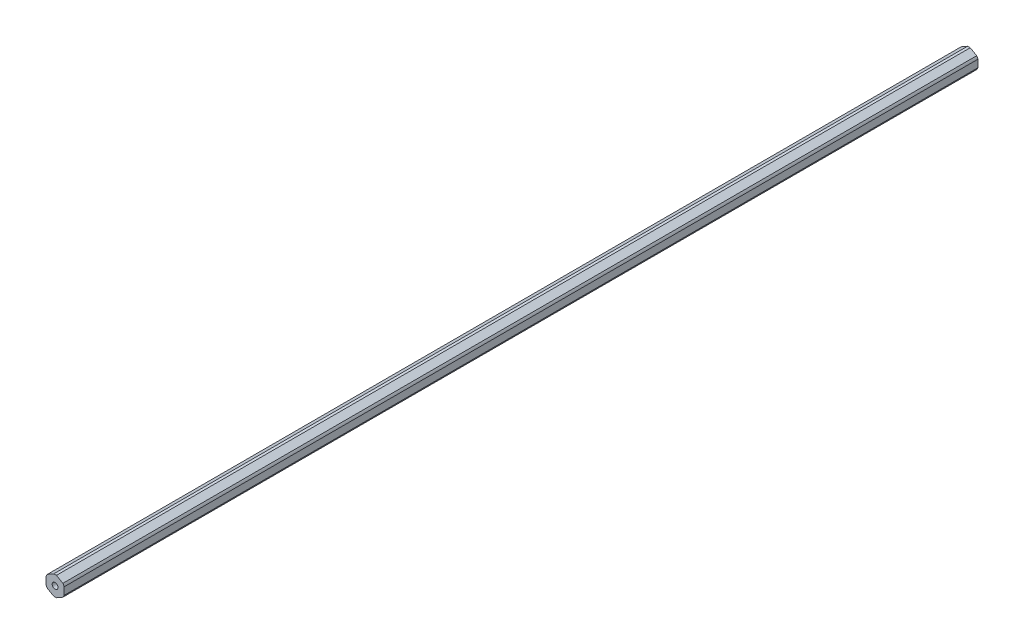
from build123d import *

# Parameters (mm, degrees)
BOSS_EXTRUDE1_DEPTH                  = 319.0875
F_10_32_TAPPED_HOLE1_D               = 4.0386
F_10_32_TAPPED_HOLE1_DEPTH           = 11.938
F_10_32_TAPPED_HOLE1_TIP             = 1.213317848
F_10_32_TAPPED_HOLE1_ON_FACE_2_D     = 4.0386
F_10_32_TAPPED_HOLE1_ON_FACE_2_DEPTH = 11.938
F_10_32_TAPPED_HOLE1_ON_FACE_2_TIP   = 1.213317848


with BuildPart() as part:
    # Sketch1 → Boss-Extrude1 (new, symmetric)
    with BuildSketch(Plane.XY):
        with BuildLine():
            ThreePointArc((0.93173274, 6.79441227), (0, 6.858), (-0.93173274, 6.79441227))
            Line((-0.93173274, 6.79441227), (-5.41826726, 4.204110358))
            ThreePointArc((-5.41826726, 4.204110358), (-5.939202219, 3.429), (-6.35, 2.590301913))
            Line((-6.35, 2.590301913), (-6.35, -2.590301913))
            ThreePointArc((-6.35, -2.590301913), (-5.939202219, -3.429), (-5.41826726, -4.204110358))
            Line((-5.41826726, -4.204110358), (-0.93173274, -6.79441227))
            ThreePointArc((-0.93173274, -6.79441227), (0, -6.858), (0.93173274, -6.79441227))
            Line((0.93173274, -6.79441227), (5.41826726, -4.204110358))
            ThreePointArc((5.41826726, -4.204110358), (5.939202219, -3.429), (6.35, -2.590301913))
            Line((6.35, -2.590301913), (6.35, 2.590301913))
            ThreePointArc((6.35, 2.590301913), (5.939202219, 3.429), (5.41826726, 4.204110358))
            Line((5.41826726, 4.204110358), (0.93173274, 6.79441227))
        make_face()
    extrude(amount=BOSS_EXTRUDE1_DEPTH, both=True)

    # #10-32 Tapped Hole1
    with Locations(Plane.XY.offset(319.0875)):
        with Locations((0, 0)):
            Hole(F_10_32_TAPPED_HOLE1_D / 2, depth=F_10_32_TAPPED_HOLE1_DEPTH)
            with Locations((0, 0, -(F_10_32_TAPPED_HOLE1_DEPTH + F_10_32_TAPPED_HOLE1_TIP / 2))):  # 118° drill point
                Cone(0, F_10_32_TAPPED_HOLE1_D / 2, F_10_32_TAPPED_HOLE1_TIP, mode=Mode.SUBTRACT)

    # #10-32 Tapped Hole1 on face 2
    with Locations(Plane(origin=(0, 0, -319.0875), x_dir=(-1, 0, 0), z_dir=(0, 0, -1))):
        with Locations((0, 0)):
            Hole(F_10_32_TAPPED_HOLE1_ON_FACE_2_D / 2, depth=F_10_32_TAPPED_HOLE1_ON_FACE_2_DEPTH)
            with Locations((0, 0, -(F_10_32_TAPPED_HOLE1_ON_FACE_2_DEPTH + F_10_32_TAPPED_HOLE1_ON_FACE_2_TIP / 2))):  # 118° drill point
                Cone(0, F_10_32_TAPPED_HOLE1_ON_FACE_2_D / 2, F_10_32_TAPPED_HOLE1_ON_FACE_2_TIP, mode=Mode.SUBTRACT)


solid = part.part
